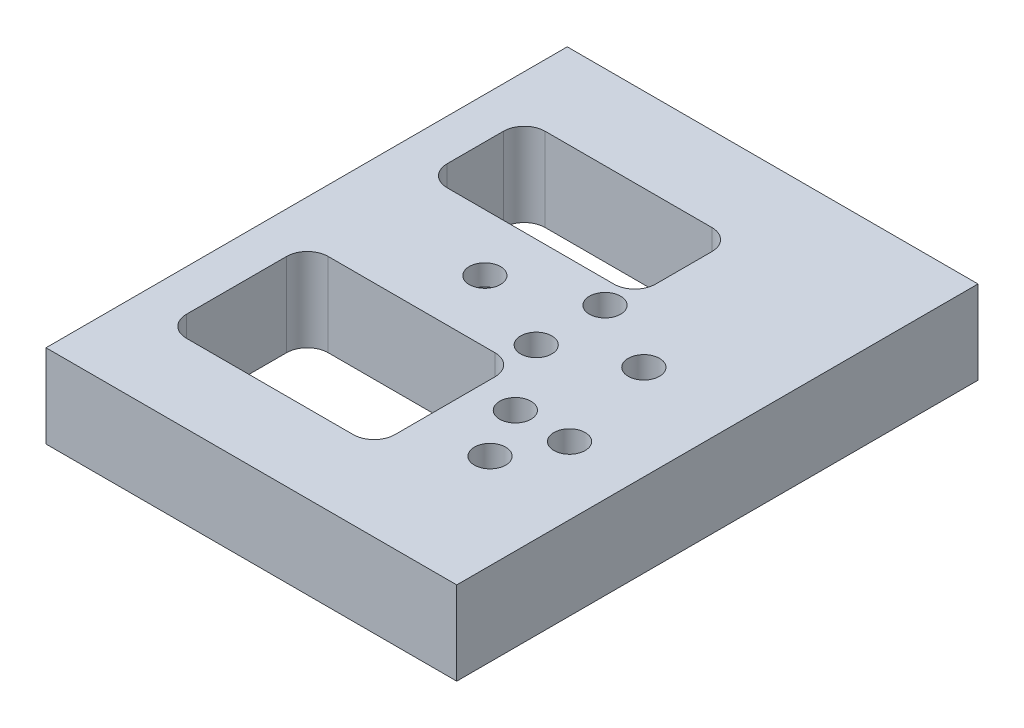
from build123d import *

# Parameters (mm, degrees)
SKETCH1_W           = 197
SKETCH1_H           = 250
BOSS_EXTRUDE1_DEPTH = 40
CUT_EXTRUDE2_REACH  = 166.095
SKETCH3_R           = 7.5
SKETCH4_R           = 9
CUT_EXTRUDE3_DEPTH  = 5
SKETCH11_R          = 7.5
CUT_EXTRUDE9_DEPTH  = 229.157307356
SKETCH12_R          = 10
CUT_EXTRUDE10_DEPTH = 5
SKETCH13_R          = 10
CUT_EXTRUDE11_DEPTH = 30


with BuildPart() as part:
    # Sketch1 → Boss-Extrude1 (new body)
    with BuildSketch(Plane(origin=(0, 0, 0), x_dir=(1, 0, 0), z_dir=(0, 1, 0))):
        Rectangle(SKETCH1_W, SKETCH1_H)
    extrude(amount=-BOSS_EXTRUDE1_DEPTH)

    # Sketch3 → Cut-Extrude2 (cut, up to next)
    with BuildSketch(Plane(origin=(0, 0, 0), x_dir=(1, 0, 0), z_dir=(0, 1, 0)), mode=Mode.PRIVATE) as cut_extrude2_sk1:
        with Locations((17.88, 26.73)):
            Circle(SKETCH3_R)
    cut_extrude2_tool1 = extrude(cut_extrude2_sk1.sketch, amount=-CUT_EXTRUDE2_REACH, mode=Mode.PRIVATE) & part.part
    # Sketch3 → Cut-Extrude2 (cut, up to next)
    with BuildSketch(Plane(origin=(0, 0, 0), x_dir=(1, 0, 0), z_dir=(0, 1, 0)), mode=Mode.PRIVATE) as cut_extrude2_sk2:
        with Locations((17.88, -6.27)):
            Circle(SKETCH3_R)
    cut_extrude2_tool2 = extrude(cut_extrude2_sk2.sketch, amount=-CUT_EXTRUDE2_REACH, mode=Mode.PRIVATE) & part.part
    # Sketch3 → Cut-Extrude2 (cut, up to next)
    with BuildSketch(Plane(origin=(0, 0, 0), x_dir=(1, 0, 0), z_dir=(0, 1, 0)), mode=Mode.PRIVATE) as cut_extrude2_sk3:
        with Locations((53, -63.53)):
            Circle(SKETCH3_R)
    cut_extrude2_tool3 = extrude(cut_extrude2_sk3.sketch, amount=-CUT_EXTRUDE2_REACH, mode=Mode.PRIVATE) & part.part
    # Sketch3 → Cut-Extrude2 (cut, up to next)
    with BuildSketch(Plane(origin=(0, 0, 0), x_dir=(1, 0, 0), z_dir=(0, 1, 0)), mode=Mode.PRIVATE) as cut_extrude2_sk4:
        with Locations((66, -38.4)):
            Circle(SKETCH3_R)
    cut_extrude2_tool4 = extrude(cut_extrude2_sk4.sketch, amount=-CUT_EXTRUDE2_REACH, mode=Mode.PRIVATE) & part.part
    # Sketch3 → Cut-Extrude2 (cut, up to next)
    with BuildSketch(Plane(origin=(0, 0, 0), x_dir=(1, 0, 0), z_dir=(0, 1, 0)), mode=Mode.PRIVATE) as cut_extrude2_sk5:
        with Locations((40, -38.4)):
            Circle(SKETCH3_R)
    cut_extrude2_tool5 = extrude(cut_extrude2_sk5.sketch, amount=-CUT_EXTRUDE2_REACH, mode=Mode.PRIVATE) & part.part
    # Sketch3 → Cut-Extrude2 (cut, up to next)
    with BuildSketch(Plane(origin=(0, 0, 0), x_dir=(1, 0, 0), z_dir=(0, 1, 0)), mode=Mode.PRIVATE) as cut_extrude2_sk6:
        with BuildLine():
            Line((-68.745, 84.63), (11.255, 84.63))
            ThreePointArc((11.255, 84.63), (18.326067812, 81.701067812), (21.255, 74.63))
            Line((21.255, 74.63), (21.255, 47.63))
            ThreePointArc((21.255, 47.63), (18.326067812, 40.558932188), (11.255, 37.63))
            Line((11.255, 37.63), (-68.745, 37.63))
            ThreePointArc((-68.745, 37.63), (-75.816067812, 40.558932188), (-78.745, 47.63))
            Line((-78.745, 47.63), (-78.745, 74.63))
            ThreePointArc((-78.745, 74.63), (-75.816067812, 81.701067812), (-68.745, 84.63))
        make_face()
    cut_extrude2_tool6 = extrude(cut_extrude2_sk6.sketch, amount=-CUT_EXTRUDE2_REACH, mode=Mode.PRIVATE) & part.part
    # Sketch3 → Cut-Extrude2 (cut, up to next)
    with BuildSketch(Plane(origin=(0, 0, 0), x_dir=(1, 0, 0), z_dir=(0, 1, 0)), mode=Mode.PRIVATE) as cut_extrude2_sk7:
        with BuildLine():
            Line((-68.745, -19.4), (11.255, -19.4))
            ThreePointArc((11.255, -19.4), (18.326067812, -22.328932188), (21.255, -29.4))
            Line((21.255, -29.4), (21.255, -77.4))
            ThreePointArc((21.255, -77.4), (18.326067812, -84.471067812), (11.255, -87.4))
            Line((11.255, -87.4), (-68.745, -87.4))
            ThreePointArc((-68.745, -87.4), (-75.816067812, -84.471067812), (-78.745, -77.4))
            Line((-78.745, -77.4), (-78.745, -29.4))
            ThreePointArc((-78.745, -29.4), (-75.816067812, -22.328932188), (-68.745, -19.4))
        make_face()
    cut_extrude2_tool7 = extrude(cut_extrude2_sk7.sketch, amount=-CUT_EXTRUDE2_REACH, mode=Mode.PRIVATE) & part.part
    add(cut_extrude2_tool1.solids().sort_by_distance((17.88, 0, -26.73))[0], mode=Mode.SUBTRACT)
    add(cut_extrude2_tool2.solids().sort_by_distance((17.88, 0, 6.27))[0], mode=Mode.SUBTRACT)
    add(cut_extrude2_tool3.solids().sort_by_distance((53, 0, 63.53))[0], mode=Mode.SUBTRACT)
    add(cut_extrude2_tool4.solids().sort_by_distance((66, 0, 38.4))[0], mode=Mode.SUBTRACT)
    add(cut_extrude2_tool5.solids().sort_by_distance((40, 0, 38.4))[0], mode=Mode.SUBTRACT)
    add(cut_extrude2_tool6.solids().sort_by_distance((-28.745, 0, -61.13))[0], mode=Mode.SUBTRACT)
    add(cut_extrude2_tool7.solids().sort_by_distance((-28.745, 0, 53.4))[0], mode=Mode.SUBTRACT)

    # Sketch4 → Cut-Extrude3 (cut)
    with BuildSketch(Plane.XZ.offset(40)):
        with Locations((17.88, -26.73)):
            Circle(SKETCH4_R)
        with Locations((17.88, 6.27)):
            Circle(SKETCH4_R)
        with Locations((40, 38.4)):
            Circle(SKETCH4_R)
        with Locations((66, 38.4)):
            Circle(SKETCH4_R)
        with Locations((53, 63.53)):
            Circle(SKETCH4_R)
    extrude(amount=-CUT_EXTRUDE3_DEPTH, mode=Mode.SUBTRACT)

    # Sketch11 → Cut-Extrude9 (cut, through all)
    with BuildSketch(Plane(origin=(88.13, 0, 0), x_dir=(1, 0, 0), z_dir=(0, 1, 0))):
        with Locations((-35.13, 10.23)):
            Circle(SKETCH11_R)
        with Locations((-111.38, 10.23)):
            Circle(SKETCH11_R)
    extrude(amount=-CUT_EXTRUDE9_DEPTH, mode=Mode.SUBTRACT)

    # Sketch12 → Cut-Extrude10 (cut)
    with BuildSketch(Plane(origin=(88.13, -40, 0), x_dir=(1, 0, 0), z_dir=(0, -1, 0))):
        with Locations((-35.13, -10.23)):
            Circle(SKETCH12_R)
    extrude(amount=-CUT_EXTRUDE10_DEPTH, mode=Mode.SUBTRACT)

    # Sketch13 → Cut-Extrude11 (cut)
    with BuildSketch(Plane(origin=(88.13, -40, 0), x_dir=(1, 0, 0), z_dir=(0, -1, 0))):
        with Locations((-111.38, -10.23)):
            Circle(SKETCH13_R)
    extrude(amount=-CUT_EXTRUDE11_DEPTH, mode=Mode.SUBTRACT)


solid = part.part
